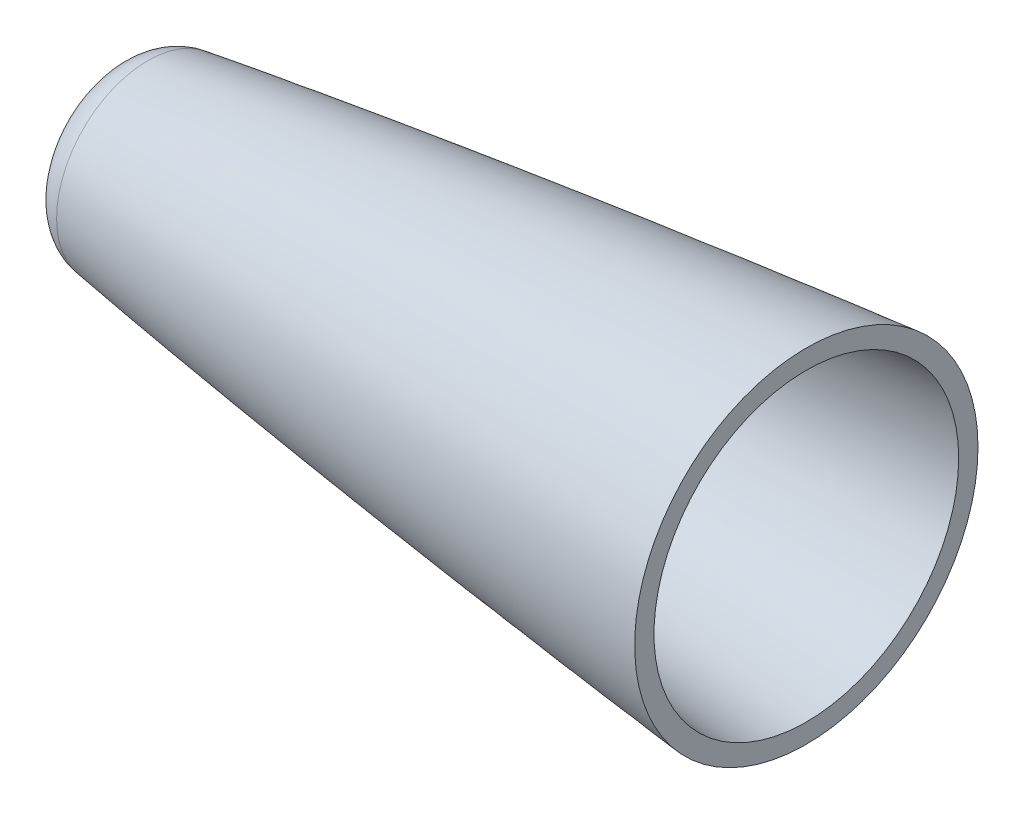
from build123d import *

# Parameters (mm, degrees)
SKETCH8_R          = 142.345864783
CUT_EXTRUDE4_DEPTH = 524.976683945
SKETCH9_R          = 2.286
CUT_EXTRUDE5_DEPTH = 10.16
SKETCH11_R         = 97.880426188
CUT_EXTRUDE7_DEPTH = 314.719746547


with BuildPart() as part:
    # Sketch1 → Revolve1 (revolve)
    with BuildSketch(Plane.XY):
        with BuildLine():
            Line((6.35, 11.460570284), (-259.812483715, 11.460570284))
            add(Edge.make_bspline(
                [(-259.812483715, 11.460570284), (-287.31210638, 10.562340852), (-342.298022137, 8.171569009), (-452.140135716, 1.833524736), (-589.280273052, -8.512118808), (-726.176632388, -21.770900754), (-835.465785428, -34.58872614), (-890.027026607, -41.965202762), (-917.245364413, -46.039623622)],
                knots=[0.121539178, 0.121539178, 0.121539178, 0.121539178, 0.200323508, 0.279107838, 0.436676499, 0.594245159, 0.67302949, 0.75181382, 0.75181382, 0.75181382, 0.75181382], degree=3))
            ThreePointArc((-917.245364413, -46.039623622), (-924.987260279, -50.310773033), (-928.0652, -58.599678629))
            Line((-928.0652, -58.599678629), (-921.7152, -58.599678629))
            ThreePointArc((-921.7152, -58.599678629), (-920.17623014, -54.455225831), (-916.305282206, -52.319651125))
            add(Edge.make_bspline(
                [(-259.605182082, 5.113954963), (-267.127682546, 4.868244998), (-283.42603151, 4.285669281), (-317.270262329, 2.880505646), (-361.130016616, 0.711244662), (-431.275457269, -3.371956494), (-501.372917975, -8.266876273), (-571.414486843, -13.891682648), (-623.914744737, -18.477698889), (-676.380314027, -23.439349795), (-728.80566324, -28.799062072), (-772.453634614, -33.627485173), (-807.34181653, -37.739154543), (-833.490683911, -40.958900147), (-859.619375692, -44.328941115), (-885.723877265, -47.869335132), (-904.612492975, -50.577906922), (-914.800968172, -52.094464395), (-916.305282206, -52.319651125)],
                knots=[0.121539178, 0.121539178, 0.121539178, 0.121539178, 0.143122913, 0.168303261, 0.218663957, 0.269024652, 0.369746043, 0.420106738, 0.470467434, 0.520828129, 0.571188825, 0.62154952, 0.646729868, 0.671910216, 0.697090564, 0.722270911, 0.747451259, 0.75181382, 0.75181382, 0.75181382, 0.75181382], degree=3))
            ThreePointArc((-259.605182082, 5.113954963), (-256.399753184, 4.364993874), (-254, 2.11179575))
            ThreePointArc((-254, 2.11179575), (-251.60858665, -0.136927523), (-248.413737762, -0.890953221))
            add(Edge.make_bspline(
                [(0, 0), (-50.8, 0), (-101.6, 0), (-157.182375328, 0), (-166.747125983, 0), (-181.094251966, 0), (-190.659002621, 0), (-199.585120865, 0), (-207.872606698, 0), (-220.304800851, -0.154959839), (-228.589711976, -0.361524821), (-235.094659099, -0.523710542), (-239.819642219, -0.641517002), (-245.046645359, -0.791480258), (-247.911294959, -0.876040976), (-248.413737762, -0.890953221)],
                knots=[0.761574077, 0.761574077, 0.761574077, 0.761574077, 0.907841521, 0.907841521, 0.921611321, 0.935381121, 0.94915092, 0.94915092, 0.961081918, 0.973012916, 0.984943914, 0.984943914, 0.991748303, 0.998552693, 1, 1, 1, 1], degree=3))
            Line((0, 0), (6.35, 0))
            Line((6.35, 0), (6.35, 11.460570284))
        make_face()
    revolve(axis=Axis((0, -76.2, 0), (-1, 0, 0)))

    # Sketch8 → Cut-Extrude4 (cut, through all)
    with BuildSketch(Plane(origin=(-438.15, 0, 0), x_dir=(0, 0, -1), z_dir=(1, 0, 0))):
        with Locations((0, -76.2)):
            Circle(SKETCH8_R)
    extrude(amount=CUT_EXTRUDE4_DEPTH, mode=Mode.SUBTRACT)

    # Sketch9 → Cut-Extrude5 (cut)
    with BuildSketch(Plane(origin=(-438.15, 0, 0), x_dir=(0, 0, -1), z_dir=(1, 0, 0))):
        with Locations((23.926020811, -4.692661383)):
            Circle(SKETCH9_R)
        with Locations((61.387516514, -32.412710015)):
            Circle(SKETCH9_R)
        with Locations((75.401067393, -76.858015146)):
            Circle(SKETCH9_R)
        with Locations((60.613973316, -121.051980857)):
            Circle(SKETCH9_R)
        with Locations((22.674401626, -148.114014343)):
            Circle(SKETCH9_R)
        with Locations((-23.926020811, -147.707338617)):
            Circle(SKETCH9_R)
        with Locations((-61.387516514, -119.987289985)):
            Circle(SKETCH9_R)
        with Locations((-75.401067393, -75.541984854)):
            Circle(SKETCH9_R)
        with Locations((-60.613973316, -31.348019143)):
            Circle(SKETCH9_R)
        with Locations((-22.674401626, -4.285985657)):
            Circle(SKETCH9_R)
    extrude(amount=-CUT_EXTRUDE5_DEPTH, mode=Mode.SUBTRACT)

    # Sketch11 → Cut-Extrude7 (cut, through all)
    with BuildSketch(Plane(origin=(-699.4652, 0, 0), x_dir=(0, 0, -1), z_dir=(1, 0, 0))):
        with Locations((0, -76.2)):
            Circle(SKETCH11_R)
    extrude(amount=CUT_EXTRUDE7_DEPTH, mode=Mode.SUBTRACT)


solid = part.part
